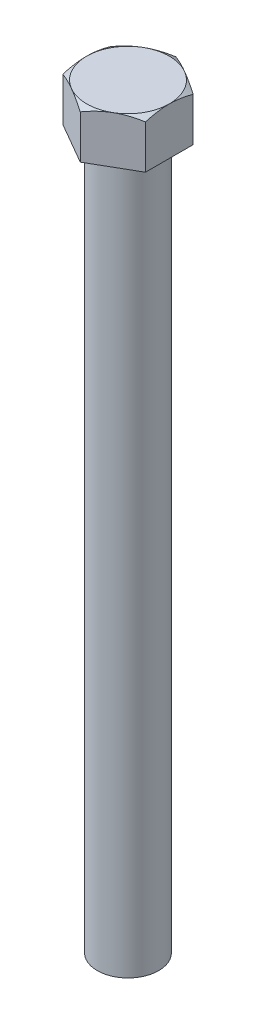
from build123d import *

# Parameters (mm, degrees)
BOSS_EXTRUDE1_DEPTH = 2.54
SKETCH2_OUTSIDE_W   = 31.388
SKETCH2_OUTSIDE_H   = 32.764
SKETCH2_OUTSIDE_R   = 4.445
CUT_EXTRUDE1_DEPTH  = 5.08
CUT_EXTRUDE1_DRAFT  = -60
SKETCH3_R           = 3.302
BOSS_EXTRUDE2_DEPTH = 76.2


with BuildPart() as part:
    # Sketch1 → Boss-Extrude1 (new, symmetric)
    with BuildSketch(Plane(origin=(0, 0, 0), x_dir=(1, 0, 0), z_dir=(0, 1, 0))):
        Polygon((0, 5.132643893), (-4.445, 2.566321947), (-4.445, -2.566321947), (0, -5.132643893), (4.445, -2.566321947), (4.445, 2.566321947), align=None)
    extrude(amount=BOSS_EXTRUDE1_DEPTH, both=True)


with BuildPart() as cut_extrude1_tool:
    # Sketch2 outside → Cut-Extrude1 (with draft: the straight prism first)
    with BuildSketch(Plane(origin=(0, 2.54, 0), x_dir=(1, 0, 0), z_dir=(0, 1, 0))):
        Rectangle(SKETCH2_OUTSIDE_W, SKETCH2_OUTSIDE_H)
        Circle(SKETCH2_OUTSIDE_R, mode=Mode.SUBTRACT)
    extrude(amount=-CUT_EXTRUDE1_DEPTH)
    # Cut-Extrude1: the draft: its side faces are tilted about the plane it starts from
    cut_extrude1_sides = [cut_extrude1_tool.faces().sort_by_distance(p)[0] for p in [
        (0, 0, 16.382),
        (15.694, 0, 0),
        (0, 0, -16.382),
        (-15.694, 0, 0),
        (-4.445, 0, 0),
    ]]
    draft(cut_extrude1_sides, Plane(origin=(0, 2.54, 0), x_dir=(1, 0, 0), z_dir=(0, 1, 0)), CUT_EXTRUDE1_DRAFT)


with BuildPart() as part_1:
    add(part.part)

    # Cut-Extrude1: cut by cut_extrude1_tool
    add(cut_extrude1_tool.part, mode=Mode.SUBTRACT)

    # Sketch3 → Boss-Extrude2 (add)
    with BuildSketch(Plane(origin=(0, -2.54, 0), x_dir=(-1, 0, 0), z_dir=(0, -1, 0))):
        Circle(SKETCH3_R)
    extrude(amount=BOSS_EXTRUDE2_DEPTH)


solid = part_1.part
